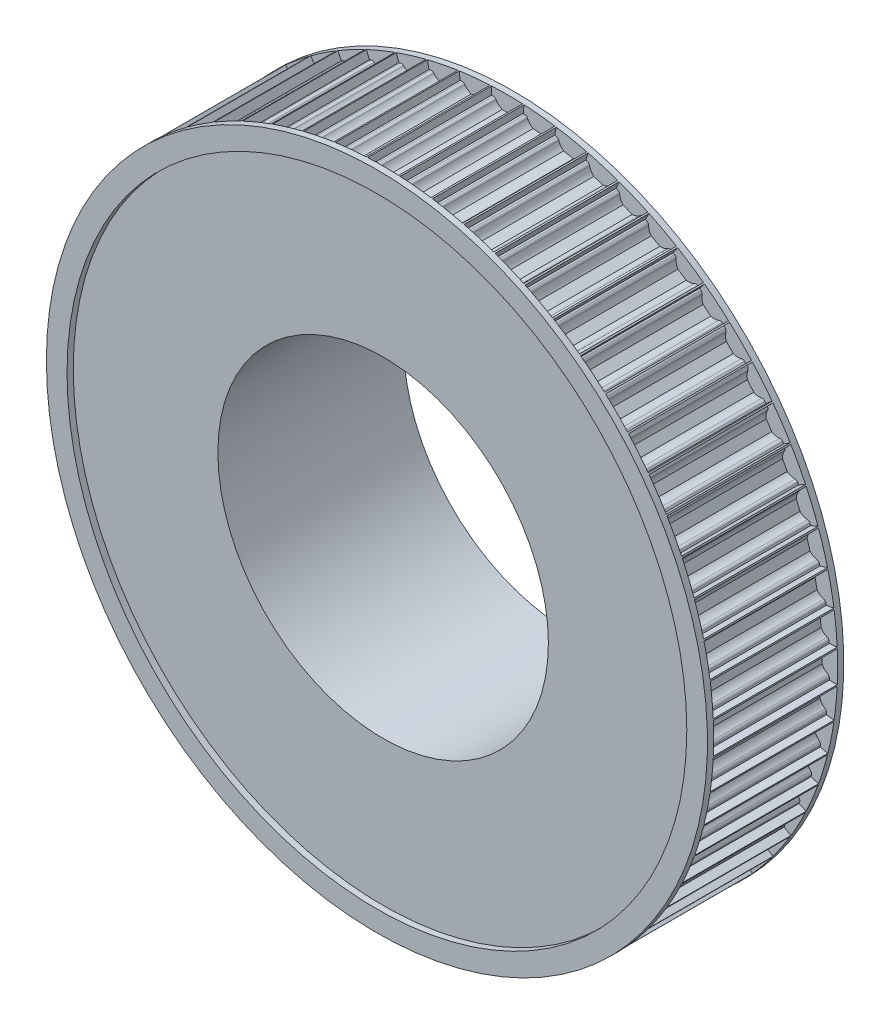
from build123d import *

# Parameters (mm, degrees)
CUT_EXTRUDE1_DEPTH = 122.757956619
CIRPATTERN1_COUNT  = 64
SKETCH3_W          = 1.5
SKETCH3_H          = 5


with BuildPart() as part:
    # Sketch1 → Revolve1 (revolve)
    with BuildSketch(Plane(origin=(0, 0, 0), x_dir=(0, 0, -1), z_dir=(1, 0, 0))):
        Polygon((0, 40), (0, 80), (30, 80), (30, 55.5), (45, 55.5), (45, 40), align=None)
    revolve(axis=Axis((0, 0, -88.99), (0, 0, 1)))

    # Sketch2 → Cut-Extrude1 (cut, through all)
    with BuildSketch(Plane.XY):
        with BuildLine():
            Line((3.31662479, 78), (3.75, 78))
            Line((3.75, 78), (3.75, 80))
            Line((3.75, 80), (-3.75, 80))
            Line((-3.75, 80), (-3.75, 78))
            Line((-3.75, 78), (-3.31662479, 78))
            ThreePointArc((-3.31662479, 78), (-2.929326456, 77.892261629), (-2.653299832, 77.6))
            ThreePointArc((-2.653299832, 77.6), (-2.040979513, 76.801272498), (-1.198957881, 76.25))
            Line((-1.198957881, 76.25), (1.198957881, 76.25))
            ThreePointArc((1.198957881, 76.25), (2.040979513, 76.801272498), (2.653299832, 77.6))
            ThreePointArc((2.653299832, 77.6), (2.929326456, 77.892261629), (3.31662479, 78))
        make_face()
    cut_extrude1 = extrude(amount=-CUT_EXTRUDE1_DEPTH, mode=Mode.SUBTRACT)

    # CirPattern1: Cut-Extrude1 ×64 about axis
    cirpattern1_axis = Axis((0, 0, -88.99), (0, 0, 1))
    for i in range(1, CIRPATTERN1_COUNT):
        add(cut_extrude1.rotate(cirpattern1_axis, i * 360 / CIRPATTERN1_COUNT), mode=Mode.SUBTRACT)

    # Sketch3 → Revolve2 (revolve)
    with BuildSketch(Plane(origin=(0, 0, 0), x_dir=(0, 0, -1), z_dir=(1, 0, 0))):
        with Locations((-0.75, 77.5)):
            Rectangle(SKETCH3_W, SKETCH3_H)
        with Locations((30.75, 77.5)):
            Rectangle(SKETCH3_W, SKETCH3_H)
    revolve(axis=Axis((0, 0, -88.99), (0, 0, 1)))


solid = part.part
